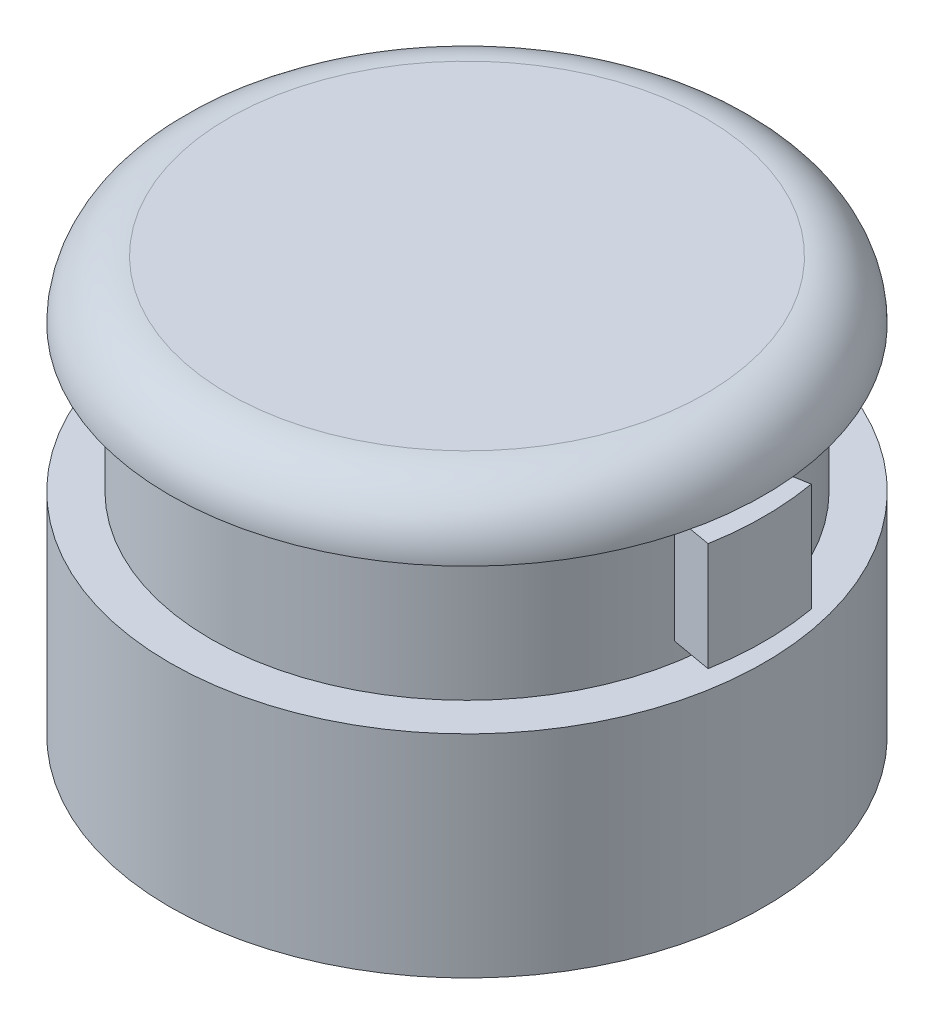
from build123d import *

# Parameters (mm, degrees)
FILLET1_R          = 4.064
SKETCH10_W         = 2.857500069
SKETCH10_H         = 7.5184
REVOLVE3_ANGLE     = 20
CUT_EXTRUDE1_START = 1.27
CUT_EXTRUDE1_DEPTH = 4.9784
CIRPATTERN4_COUNT  = 2
FILLET8_R          = 1.27
FILLET9_R          = 1.27


with BuildPart() as part:
    # Sketch1 → Revolve1 (revolve)
    with BuildSketch(Plane.XY, mode=Mode.PRIVATE) as revolve1_sk:
        Polygon((0, 9.1059), (-20.6375, 9.1059), (-20.6375, 5.042647059), (-17.78, 5.042647059), (-17.78, -5.042647059), (-20.6375, -5.042647059), (-20.6375, -19.7231), (-16.51, -19.7231), (-16.51, -15.5956), (-18.0975, -15.5956), (-18.0975, -13.3096), (-16.51, -13.3096), (-16.51, 6.7564), (-3.8481, 6.7564), (-3.0861, 7.5184), (0, 7.5184), align=None)
    revolve(revolve1_sk.sketch.rotate(Axis((0, 0, 0), (0, 1, 0)), 270), axis=Axis((0, 0, 0), (0, 1, 0)))

    # Fillet1
    # the kernel refuses this fillet: 4.064 mm, written as the material it takes off along each edge
    with BuildSketch(Plane(origin=(0, 9.1059, 0), x_dir=(0, 0, -1), z_dir=(1, 0, 0))) as fillet1_piece_1:
        with BuildLine():
            CenterArc((16.573500069, -4.064), FILLET1_R, 0.010532312, 89.989467688)
            Line((20.6375, -4.063252941), (20.718779999, -4.063238))
            Line((20.718779999, -4.063238), (20.71878, 0))
            Line((20.71878, 0), (20.6375, 0.08128))
            Line((20.6375, 0.08128), (16.573500069, 0.08128))
            Line((16.573500069, 0.08128), (16.573500069, 0))
        make_face()
    revolve(axis=Axis((0, 9.1059, 0), (0, 1, 0)), mode=Mode.SUBTRACT)

    # Sketch10 → Revolve3 (revolve, symmetric)
    with BuildSketch(Plane.XY) as revolve3_sk:
        with Locations((-19.208750034, 0)):
            Rectangle(SKETCH10_W, SKETCH10_H)
    revolve3 = revolve(axis=Axis((0, 0, 0), (0, 1, 0)), revolution_arc=REVOLVE3_ANGLE / 2)
    revolve3 = revolve3 + revolve(revolve3_sk.sketch, axis=Axis((0, 0, 0), (0, -1, 0)), revolution_arc=REVOLVE3_ANGLE / 2)

    # Sketch12 → Cut-Extrude1 (cut)
    with BuildSketch(Plane(origin=(0, -3.7592, 0), x_dir=(1, 0, 0), z_dir=(0, 1, 0)).offset(CUT_EXTRUDE1_START)):
        with BuildLine():
            Line((-7.313638514, 0), (-17.215440903, 1.745954919))
            ThreePointArc((-17.215440903, 1.745954919), (-17.30375, 0), (-17.215440903, -1.745954919))
            Line((-17.215440903, -1.745954919), (-7.313638514, 0))
        make_face()
    cut_extrude1 = extrude(amount=CUT_EXTRUDE1_DEPTH, mode=Mode.SUBTRACT)

    # CirPattern4: Revolve3, Cut-Extrude1 ×2 about axis
    cirpattern4_axis = Axis((0, 0, 0), (0, 1, 0))
    add([revolve3.rotate(cirpattern4_axis, i * 360 / CIRPATTERN4_COUNT) for i in range(1, CIRPATTERN4_COUNT)])
    add([cut_extrude1.rotate(cirpattern4_axis, i * 360 / CIRPATTERN4_COUNT) for i in range(1, CIRPATTERN4_COUNT)], mode=Mode.SUBTRACT)

    # Fillet8
    # the kernel refuses this fillet: 1.27 mm, written as the material it takes off along each edge
    with BuildSketch(Plane(origin=(-16.431533746, -2.4892, -1.607730937), x_dir=(0.1324793231915166, 0, -0.9911857691304479), z_dir=(0, 1, 0)), Plane(origin=(16.431533746, -2.4892, 1.607730937), x_dir=(-0.13247932319151873, 0, 0.9911857691304475), z_dir=(0, 1, 0))) as fillet8_piece_1:
        with BuildLine():
            CenterArc((1.211424462, 1.269207194), FILLET8_R, 201.909884157, 66.065503548)
            Line((0.033154154, 0.795309438), (0.009588748, 0.785831483))
            ThreePointArc((0.009588748, 0.785831483), (-0.008800881, 0.398712653), (-0.025377958, 0.001057934))
            Line((-0.025377958, 0.001057934), (0.000897351, -0.025384144))
            ThreePointArc((0.000897351, -0.025384144), (0.583278445, -0.01509352), (1.165659538, -0.025384144))
            Line((1.165659538, -0.025384144), (1.166556889, 0))
        make_face()
    extrude(amount=4.9784, mode=Mode.SUBTRACT)
    with BuildSketch(Plane(origin=(-16.431533746, -2.4892, 1.607730937), x_dir=(0.13247932319152245, 0, 0.9911857691304472), z_dir=(0, 1, 0)), Plane(origin=(16.431533746, -2.4892, -1.607730937), x_dir=(-0.13247932319151992, 0, -0.9911857691304475), z_dir=(0, 1, 0))) as fillet8_piece_2:
        with BuildLine():
            CenterArc((1.211424462, -1.269207194), FILLET8_R, 92.024612295, 66.065503548)
            Line((0.033154154, -0.795309438), (0.009588748, -0.785831483))
            ThreePointArc((0.009588748, -0.785831483), (-0.008800881, -0.398712653), (-0.025377958, -0.001057934))
            Line((-0.025377958, -0.001057934), (0.000897351, 0.025384144))
            ThreePointArc((0.000897351, 0.025384144), (0.583278445, 0.01509352), (1.165659538, 0.025384144))
            Line((1.165659538, 0.025384144), (1.166556889, 0))
        make_face()
    extrude(amount=4.9784, mode=Mode.SUBTRACT)

    # Fillet9
    fillet9_edges = [part.edges().sort_by_distance(p)[0] for p in [
        (-17.215440903, 0, 1.745954919),
        (-17.215440903, 0, -1.745954919),
        (17.215440903, 0, -1.745954919),
        (17.215440903, 0, 1.745954919),
    ]]
    fillet(fillet9_edges, radius=FILLET9_R)


solid = part.part
